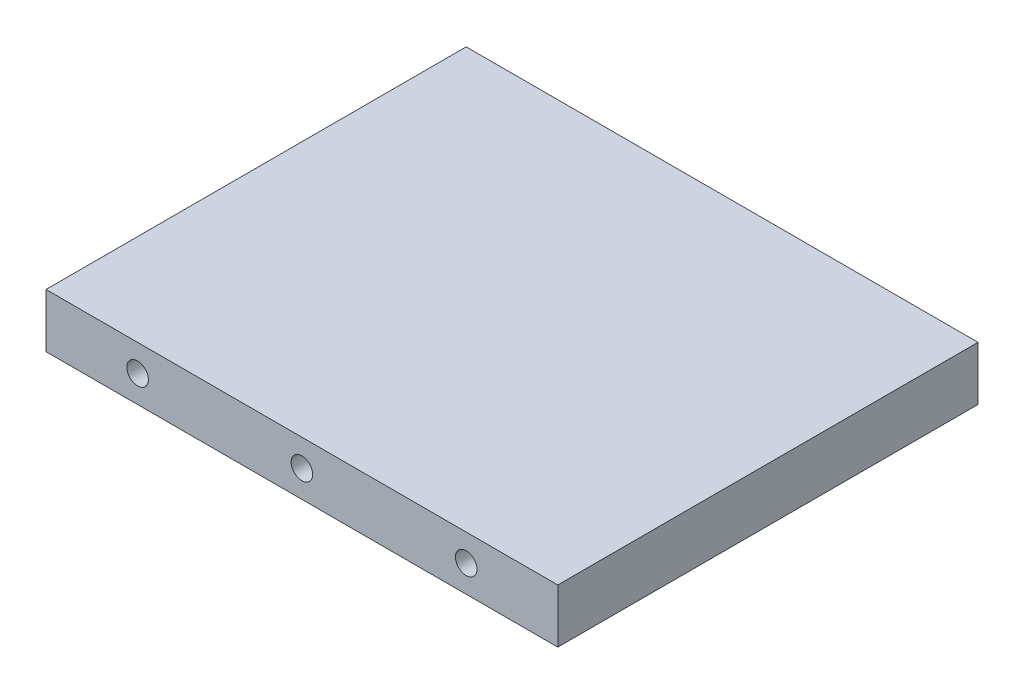
from build123d import *

# Parameters (mm, degrees)
SCHIZZO2_W                   = 95
SCHIZZO2_H                   = 10
ESTRUSIONE_ESTRUSIONE1_DEPTH = 78
SCHIZZO3_R                   = 2
TAGLIO_ESTRUSIONE1_DEPTH     = 15
TAGLIO_ESTRUSIONE2_START     = -15
SCHIZZO4_R                   = 2
TAGLIO_ESTRUSIONE2_DEPTH     = 15


with BuildPart() as part:
    # Schizzo2 → Estrusione-Estrusione1 (new body)
    with BuildSketch(Plane.XY):
        with Locations((47.5, 5)):
            Rectangle(SCHIZZO2_W, SCHIZZO2_H)
    extrude(amount=-ESTRUSIONE_ESTRUSIONE1_DEPTH)

    # Schizzo3 → Taglio-Estrusione1 (cut)
    with BuildSketch(Plane.XY):
        with Locations((17, 5)):
            Circle(SCHIZZO3_R)
        with Locations((47.5, 5)):
            Circle(SCHIZZO3_R)
        with Locations((78, 5)):
            Circle(SCHIZZO3_R)
    extrude(amount=-TAGLIO_ESTRUSIONE1_DEPTH, mode=Mode.SUBTRACT)

    # Schizzo4 → Taglio-Estrusione2 (cut)
    with BuildSketch(Plane(origin=(0, 0, -78), x_dir=(-1, 0, 0), z_dir=(0, 0, -1)).offset(TAGLIO_ESTRUSIONE2_START)):
        with Locations((-78, 5)):
            Circle(SCHIZZO4_R)
        with Locations((-47.5, 5)):
            Circle(SCHIZZO4_R)
        with Locations((-17, 5)):
            Circle(SCHIZZO4_R)
    extrude(amount=TAGLIO_ESTRUSIONE2_DEPTH, mode=Mode.SUBTRACT)


solid = part.part
